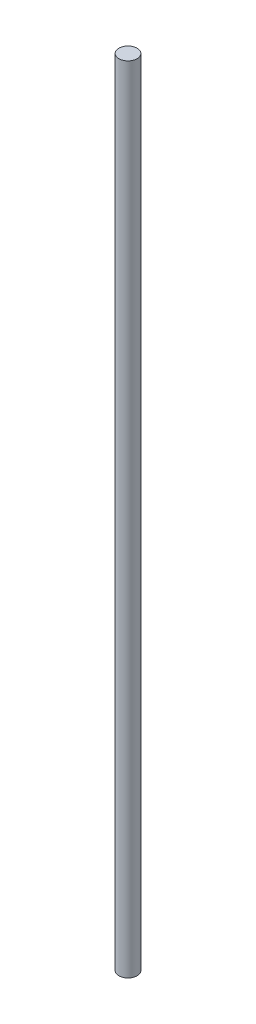
from build123d import *

# Parameters (mm, degrees)
SKETCH1_R           = 6
BOSS_EXTRUDE1_DEPTH = 523


with BuildPart() as part:
    # Sketch1 → Boss-Extrude1 (new body)
    with BuildSketch(Plane(origin=(0, 0, 0), x_dir=(1, 0, 0), z_dir=(0, 1, 0))):
        Circle(SKETCH1_R)
    extrude(amount=BOSS_EXTRUDE1_DEPTH)


solid = part.part
